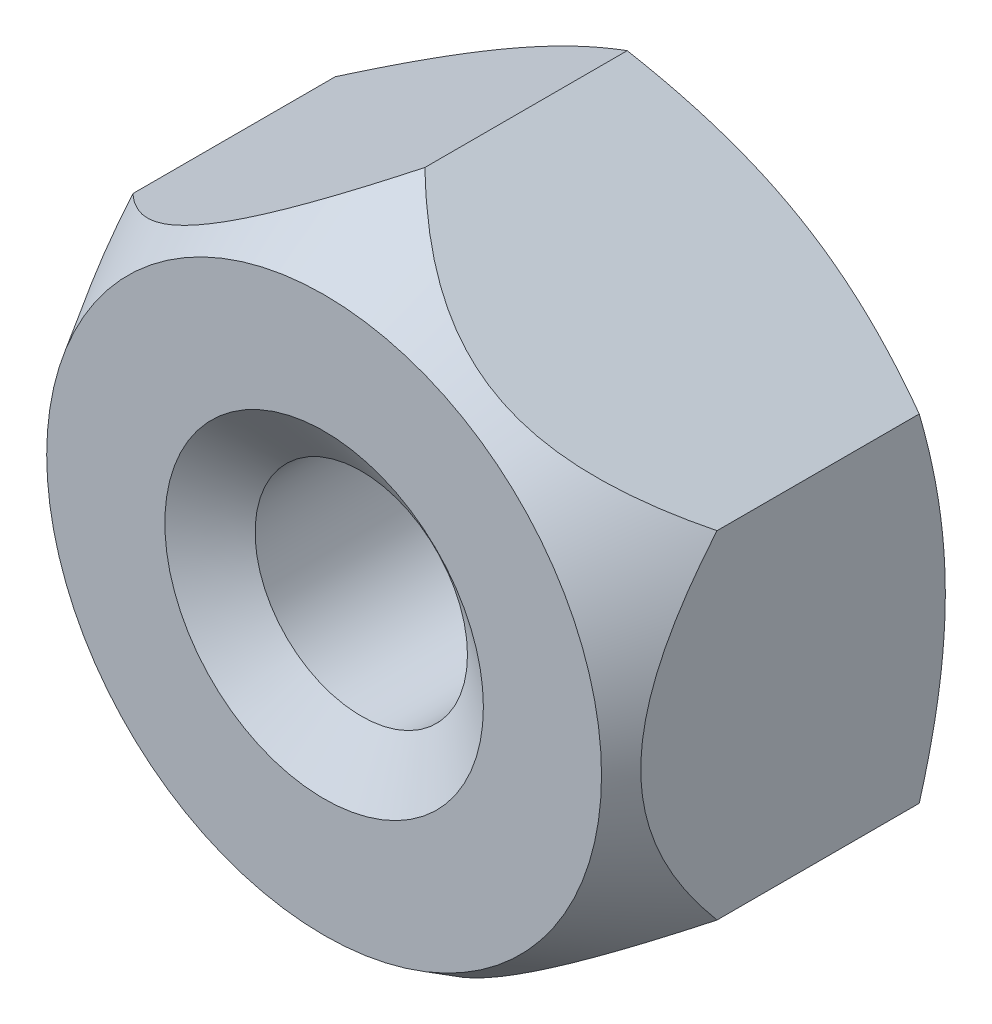
from build123d import *

# Parameters (mm, degrees)
BASENUT_START = -3.1
BASENUTSKE_R  = 1
BASENUT_DEPTH = 3.1


# Read off the part's stored shape, not the designer's step: ThreadSchematic
with BuildPart() as part:
    # BaseNutSke → BaseNut (new body)
    with BuildSketch(Plane.XY.offset(BASENUT_START)):
        Polygon((2.75, 1.58771324), (2.75, -1.58771324), (0, -3.175426481), (-2.75, -1.58771324), (-2.75, 1.58771324), (0, 3.175426481), align=None)
        Circle(BASENUTSKE_R, mode=Mode.SUBTRACT)
    extrude(amount=BASENUT_DEPTH)

    # Sketch5 (on Front Plane) → EndChamfer (revolve, cut)
    with BuildSketch(Plane.XY):
        Polygon((3.0746, 1.5), (2.689485854, 0.95), (3.1254, 0.95), (3.1254, 1.5), align=None)
    revolve(axis=Axis((3.1254, 0.95, 0), (-1, 0, 0)), mode=Mode.SUBTRACT)

    # Sketch3 → Double-Chamfer (revolve, cut)
    with BuildSketch(Plane(origin=(0, 0, 0), x_dir=(0, 0, -1), z_dir=(1, 0, 0)), mode=Mode.PRIVATE) as double_chamfer_sk:
        Polygon((3.1, 2.75), (2.854379907, 3.175426481), (2.854379907, 13.175426481), (13.1, 13.175426481), (13.1, 2.75), align=None)
        Polygon((0.95, 13.175426481), (-10, 13.175426481), (-10, 2.6125), (0, 2.6125), (0.95, 3.175426481), align=None)
    revolve(double_chamfer_sk.sketch.rotate(Axis((0, 0, 0), (0, 0, -1)), 300.000001719), axis=Axis((0, 0, 0), (0, 0, -1)), mode=Mode.SUBTRACT)

    # ThreadSchematic outline → ThreadSchematic (revolve, cut)
    with BuildSketch(Plane.XZ):
        Polygon((1, 0), (1, -0.350103769), (1.5, 0), align=None)
        Polygon((1.5, -3.0746), (1, -2.724496231), (1, -3.1), (1.5, -3.1), align=None)
    revolve(axis=Axis((0, 0, 0), (0, 0, 1)), mode=Mode.SUBTRACT)


solid = part.part
